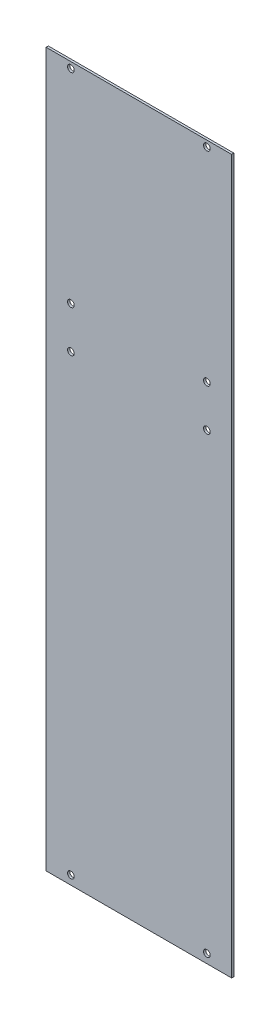
from build123d import *

# Parameters (mm, degrees)
SKETCH1_W                = 83.2
SKETCH1_H                = 320
BOSS_EXTRUDE1_DEPTH      = 1
F_3_0_3_DIAMETER_HOLE1_D = 3


with BuildPart() as part:
    # Sketch1 → Boss-Extrude1 (new body)
    with BuildSketch(Plane.XY):
        Rectangle(SKETCH1_W, SKETCH1_H)
    extrude(amount=BOSS_EXTRUDE1_DEPTH)

    # Ø3.0 (3) Diameter Hole1 (through all)
    with Locations(Plane.XY.offset(1)):
        with Locations((-30.5, 66), (30.5, 66), (30.5, -156), (-30.5, -156), (-30.5, 157.3), (30.5, 157.3), (-30.5, 47.3), (30.5, 47.3)):
            Hole(F_3_0_3_DIAMETER_HOLE1_D / 2)


solid = part.part
